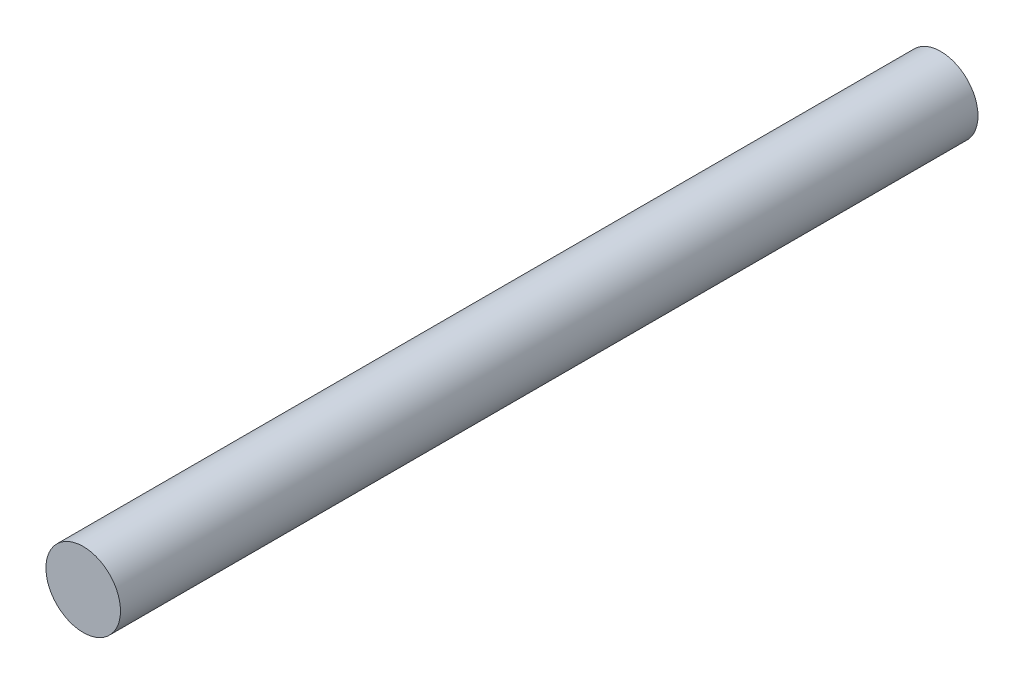
from build123d import *

# Parameters (mm, degrees)
SKETCH1_R           = 3.175
BOSS_EXTRUDE1_DEPTH = 73.025


with BuildPart() as part:
    # Sketch1 → Boss-Extrude1 (new body)
    with BuildSketch(Plane.XY):
        Circle(SKETCH1_R)
    extrude(amount=BOSS_EXTRUDE1_DEPTH)


solid = part.part
